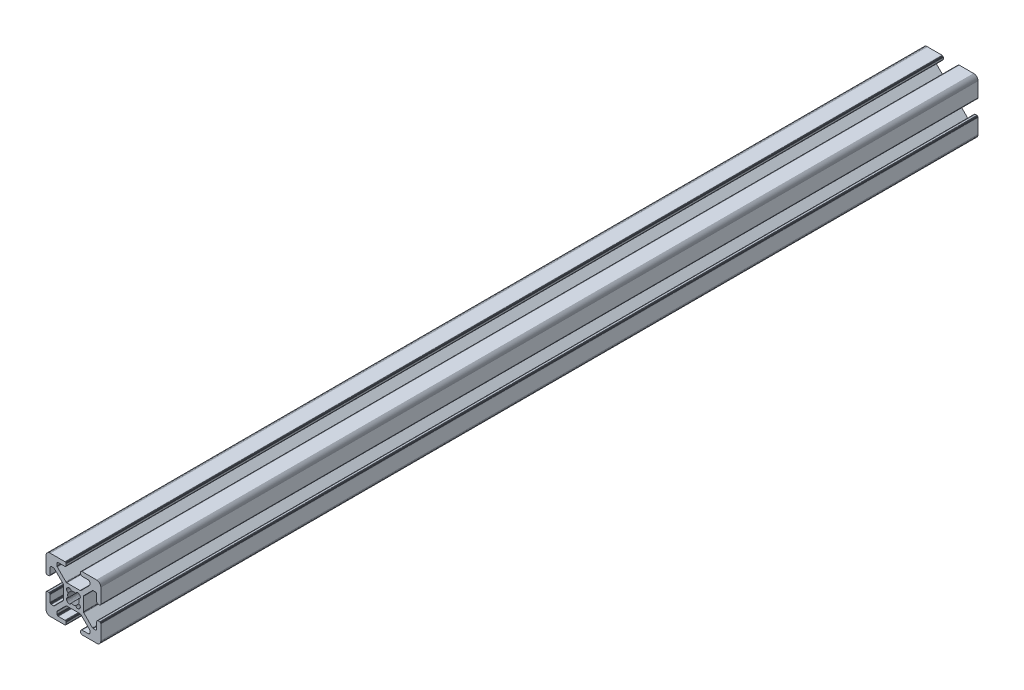
from build123d import *

# Parameters (mm, degrees)
BOSS_EXTRUDE1_DEPTH = 240


with BuildPart() as part:
    # Model → Boss-Extrude1 (new body)
    with BuildSketch(Plane.XY):
        Polygon((949.318453514, 626.491065369), (949.298187669, 626.47654307), (949.278915018, 626.460726414), (949.26071809, 626.443683131), (946.933407593, 624.116372635), (946.91636431, 624.098175706), (946.900547654, 624.078903055), (946.886025355, 624.05863721), (946.872859598, 624.037464951), (946.861106763, 624.015476942), (946.850817175, 623.992767339), (946.842034898, 623.969433387), (946.834797537, 623.945575007), (946.829136085, 623.921294364), (946.825074785, 623.89669543), (946.822631027, 623.871883543), (946.821815277, 623.846964951), (946.821815277, 620.271085943), (946.822631027, 620.246167351), (946.825074785, 620.221355464), (946.829136085, 620.19675653), (946.834797537, 620.172475887), (946.842034898, 620.148617507), (946.850817175, 620.125283555), (946.861106763, 620.102573952), (946.872859598, 620.080585943), (946.886025355, 620.059413684), (946.900547654, 620.039147839), (946.91636431, 620.019875188), (946.933407593, 620.00167826), (949.26071809, 617.674367763), (949.278915018, 617.65732448), (949.298187669, 617.641507824), (949.318453514, 617.626985525), (949.339625773, 617.613819768), (949.361613782, 617.602066933), (949.384323385, 617.591777345), (949.407657337, 617.582995068), (949.431515717, 617.575757707), (949.455796361, 617.570096255), (949.480395294, 617.566034955), (949.505207181, 617.563591197), (949.530125773, 617.562775447), (950.074565277, 617.562775447), (950.124295756, 617.566034955), (950.173175333, 617.575757707), (950.220367665, 617.591777345), (950.265065277, 617.613819768), (950.306503382, 617.641507824), (950.343972961, 617.674367763), (950.3768329, 617.711837343), (950.404520956, 617.753275447), (950.426563379, 617.797973059), (950.442583017, 617.845165391), (950.452305769, 617.894044968), (950.455565277, 617.943775447), (950.455565277, 619.705525447), (950.458824785, 619.755255926), (950.468547537, 619.804135503), (950.484567175, 619.851327835), (950.506609598, 619.896025447), (950.534297654, 619.937463551), (950.567157593, 619.974933131), (950.604627173, 620.00779307), (950.646065277, 620.035481126), (950.690762889, 620.057523549), (950.737955221, 620.073543187), (950.786834798, 620.083265939), (950.836565277, 620.086525447), (951.199565277, 620.086525447), (951.249295756, 620.083265939), (951.298175333, 620.073543187), (951.345367665, 620.057523549), (951.390065277, 620.035481126), (951.431503382, 620.00779307), (951.468972961, 619.974933131), (951.5018329, 619.937463551), (951.529520956, 619.896025447), (951.551563379, 619.851327835), (951.567583017, 619.804135503), (951.577305769, 619.755255926), (951.580565277, 619.705525447), (951.580565277, 615.684025447), (951.570940746, 615.537183481), (951.542231832, 615.392854021), (951.494929751, 615.253506586), (951.429843856, 615.121525447), (951.348087785, 614.999168839), (951.251060406, 614.888530318), (951.140421885, 614.791502939), (951.018065277, 614.709746868), (950.886084138, 614.644660973), (950.746736703, 614.597358892), (950.602407243, 614.568649978), (950.455565277, 614.559025447), (946.434065277, 614.559025447), (946.384334798, 614.562284955), (946.335455221, 614.572007707), (946.288262889, 614.588027345), (946.243565277, 614.610069768), (946.202127173, 614.637757824), (946.164657593, 614.670617763), (946.131797654, 614.708087343), (946.104109598, 614.749525447), (946.082067175, 614.794223059), (946.066047537, 614.841415391), (946.056324785, 614.890294968), (946.053065277, 614.940025447), (946.053065277, 615.303025447), (946.056324785, 615.352755926), (946.066047537, 615.401635503), (946.082067175, 615.448827835), (946.104109598, 615.493525447), (946.131797654, 615.534963551), (946.164657593, 615.572433131), (946.202127173, 615.60529307), (946.243565277, 615.632981126), (946.288262889, 615.655023549), (946.335455221, 615.671043187), (946.384334798, 615.680765939), (946.434065277, 615.684025447), (948.195815277, 615.684025447), (948.245545756, 615.687284955), (948.294425333, 615.697007707), (948.341617665, 615.713027345), (948.386315277, 615.735069768), (948.427753382, 615.762757824), (948.465222961, 615.795617763), (948.4980829, 615.833087343), (948.525770956, 615.874525447), (948.547813379, 615.919223059), (948.563833017, 615.966415391), (948.573555769, 616.015294968), (948.576815277, 616.065025447), (948.576815277, 616.609464951), (948.575999527, 616.634383543), (948.573555769, 616.65919543), (948.569494469, 616.683794364), (948.563833017, 616.708075007), (948.556595656, 616.731933387), (948.547813379, 616.755267339), (948.537523792, 616.777976942), (948.525770956, 616.799964951), (948.512605199, 616.82113721), (948.4980829, 616.841403055), (948.482266244, 616.860675706), (948.465222961, 616.878872635), (946.137912465, 619.206183131), (946.119715536, 619.223226414), (946.100442885, 619.23904307), (946.08017704, 619.253565369), (946.059004781, 619.266731126), (946.037016772, 619.278483962), (946.014307169, 619.288773549), (945.990973217, 619.297555826), (945.967114837, 619.304793187), (945.942834194, 619.310454639), (945.91823526, 619.314515939), (945.893423373, 619.316959697), (945.868504781, 619.317775447), (944.080565277, 619.317775447), (942.292625773, 619.317775447), (942.267707181, 619.316959697), (942.242895294, 619.314515939), (942.218296361, 619.310454639), (942.194015717, 619.304793187), (942.170157337, 619.297555826), (942.146823385, 619.288773549), (942.124113782, 619.278483962), (942.102125773, 619.266731126), (942.080953514, 619.253565369), (942.060687669, 619.23904307), (942.041415018, 619.223226414), (942.02321809, 619.206183131), (939.695907593, 616.878872635), (939.67886431, 616.860675706), (939.663047654, 616.841403055), (939.648525355, 616.82113721), (939.635359598, 616.799964951), (939.623606763, 616.777976942), (939.613317175, 616.755267339), (939.604534898, 616.731933387), (939.597297537, 616.708075007), (939.591636085, 616.683794364), (939.587574785, 616.65919543), (939.585131027, 616.634383543), (939.584315277, 616.609464951), (939.584315277, 616.065025447), (939.587574785, 616.015294968), (939.597297537, 615.966415391), (939.613317175, 615.919223059), (939.635359598, 615.874525447), (939.663047654, 615.833087343), (939.695907593, 615.795617763), (939.733377173, 615.762757824), (939.774815277, 615.735069768), (939.819512889, 615.713027345), (939.866705221, 615.697007707), (939.915584798, 615.687284955), (939.965315277, 615.684025447), (941.727065277, 615.684025447), (941.776795756, 615.680765939), (941.825675333, 615.671043187), (941.872867665, 615.655023549), (941.917565277, 615.632981126), (941.959003382, 615.60529307), (941.996472961, 615.572433131), (942.0293329, 615.534963551), (942.057020956, 615.493525447), (942.079063379, 615.448827835), (942.095083017, 615.401635503), (942.104805769, 615.352755926), (942.108065277, 615.303025447), (942.108065277, 614.940025447), (942.104805769, 614.890294968), (942.095083017, 614.841415391), (942.079063379, 614.794223059), (942.057020956, 614.749525447), (942.0293329, 614.708087343), (941.996472961, 614.670617763), (941.959003382, 614.637757824), (941.917565277, 614.610069768), (941.872867665, 614.588027345), (941.825675333, 614.572007707), (941.776795756, 614.562284955), (941.727065277, 614.559025447), (937.705565277, 614.559025447), (937.558723311, 614.568649978), (937.414393851, 614.597358892), (937.275046416, 614.644660973), (937.143065277, 614.709746868), (937.020708669, 614.791502939), (936.910070148, 614.888530318), (936.813042769, 614.999168839), (936.731286698, 615.121525447), (936.666200803, 615.253506586), (936.618898722, 615.392854021), (936.590189808, 615.537183481), (936.580565277, 615.684025447), (936.580565277, 619.705525447), (936.583824785, 619.755255926), (936.593547537, 619.804135503), (936.609567175, 619.851327835), (936.631609598, 619.896025447), (936.659297654, 619.937463551), (936.692157593, 619.974933131), (936.729627173, 620.00779307), (936.771065277, 620.035481126), (936.815762889, 620.057523549), (936.862955221, 620.073543187), (936.911834798, 620.083265939), (936.961565277, 620.086525447), (937.324565277, 620.086525447), (937.374295756, 620.083265939), (937.423175333, 620.073543187), (937.470367665, 620.057523549), (937.515065277, 620.035481126), (937.556503382, 620.00779307), (937.593972961, 619.974933131), (937.6268329, 619.937463551), (937.654520956, 619.896025447), (937.676563379, 619.851327835), (937.692583017, 619.804135503), (937.702305769, 619.755255926), (937.705565277, 619.705525447), (937.705565277, 617.943775447), (937.708824785, 617.894044968), (937.718547537, 617.845165391), (937.734567175, 617.797973059), (937.756609598, 617.753275447), (937.784297654, 617.711837343), (937.817157593, 617.674367763), (937.854627173, 617.641507824), (937.896065277, 617.613819768), (937.940762889, 617.591777345), (937.987955221, 617.575757707), (938.036834798, 617.566034955), (938.086565277, 617.562775447), (938.631004781, 617.562775447), (938.655923373, 617.563591197), (938.68073526, 617.566034955), (938.705334194, 617.570096255), (938.729614837, 617.575757707), (938.753473217, 617.582995068), (938.776807169, 617.591777345), (938.799516772, 617.602066933), (938.821504781, 617.613819768), (938.84267704, 617.626985525), (938.862942885, 617.641507824), (938.882215536, 617.65732448), (938.900412465, 617.674367763), (941.227722961, 620.00167826), (941.244766244, 620.019875188), (941.2605829, 620.039147839), (941.275105199, 620.059413684), (941.288270956, 620.080585943), (941.300023792, 620.102573952), (941.310313379, 620.125283555), (941.319095656, 620.148617507), (941.326333017, 620.172475887), (941.331994469, 620.19675653), (941.336055769, 620.221355464), (941.338499527, 620.246167351), (941.339315277, 620.271085943), (941.339315277, 623.846964951), (941.338499527, 623.871883543), (941.336055769, 623.89669543), (941.331994469, 623.921294364), (941.326333017, 623.945575007), (941.319095656, 623.969433387), (941.310313379, 623.992767339), (941.300023792, 624.015476942), (941.288270956, 624.037464951), (941.275105199, 624.05863721), (941.2605829, 624.078903055), (941.244766244, 624.098175706), (941.227722961, 624.116372635), (938.900412465, 626.443683131), (938.882215537, 626.460726414), (938.862942885, 626.47654307), (938.84267704, 626.491065369), (938.821504781, 626.504231126), (938.799516772, 626.515983962), (938.776807169, 626.526273549), (938.753473217, 626.535055826), (938.729614837, 626.542293187), (938.705334194, 626.547954639), (938.68073526, 626.552015939), (938.655923373, 626.554459697), (938.631004781, 626.555275447), (938.086565277, 626.555275447), (938.036834798, 626.552015939), (937.987955221, 626.542293187), (937.940762889, 626.526273549), (937.896065277, 626.504231126), (937.854627173, 626.47654307), (937.817157593, 626.443683131), (937.784297654, 626.406213552), (937.756609598, 626.364775447), (937.734567175, 626.320077835), (937.718547537, 626.272885503), (937.708824785, 626.224005926), (937.705565277, 626.174275447), (937.705565277, 624.412525447), (937.702305769, 624.362794968), (937.692583017, 624.313915391), (937.676563379, 624.266723059), (937.654520956, 624.222025447), (937.6268329, 624.180587343), (937.593972961, 624.143117763), (937.556503382, 624.110257824), (937.515065277, 624.082569768), (937.470367665, 624.060527345), (937.423175333, 624.044507707), (937.374295756, 624.034784955), (937.324565277, 624.031525447), (936.961565277, 624.031525447), (936.911834798, 624.034784955), (936.862955221, 624.044507707), (936.815762889, 624.060527345), (936.771065277, 624.082569768), (936.729627173, 624.110257824), (936.692157593, 624.143117763), (936.659297654, 624.180587343), (936.631609598, 624.222025447), (936.609567175, 624.266723059), (936.593547537, 624.313915391), (936.583824785, 624.362794968), (936.580565277, 624.412525447), (936.580565277, 628.434025447), (936.590189808, 628.580867413), (936.618898723, 628.725196873), (936.666200803, 628.864544308), (936.731286698, 628.996525447), (936.813042769, 629.118882055), (936.910070148, 629.229520576), (937.020708669, 629.326547955), (937.143065277, 629.408304026), (937.275046416, 629.473389921), (937.414393851, 629.520692002), (937.558723311, 629.549400916), (937.705565277, 629.559025447), (941.727065277, 629.559025447), (941.776795756, 629.555765939), (941.825675333, 629.546043187), (941.872867665, 629.530023549), (941.917565277, 629.507981126), (941.959003382, 629.48029307), (941.996472961, 629.447433131), (942.0293329, 629.409963552), (942.057020956, 629.368525447), (942.079063379, 629.323827835), (942.095083017, 629.276635503), (942.104805769, 629.227755926), (942.108065277, 629.178025447), (942.108065277, 628.815025447), (942.104805769, 628.765294968), (942.095083017, 628.716415391), (942.079063379, 628.669223059), (942.057020956, 628.624525447), (942.0293329, 628.583087343), (941.996472961, 628.545617763), (941.959003382, 628.512757824), (941.917565277, 628.485069768), (941.872867665, 628.463027345), (941.825675333, 628.447007707), (941.776795756, 628.437284955), (941.727065277, 628.434025447), (939.965315277, 628.434025447), (939.915584798, 628.430765939), (939.866705221, 628.421043187), (939.819512889, 628.405023549), (939.774815277, 628.382981126), (939.733377173, 628.35529307), (939.695907593, 628.322433131), (939.663047654, 628.284963552), (939.635359598, 628.243525447), (939.613317175, 628.198827835), (939.597297537, 628.151635503), (939.587574785, 628.102755926), (939.584315277, 628.053025447), (939.584315277, 627.508585943), (939.585131027, 627.483667351), (939.587574785, 627.458855464), (939.591636085, 627.43425653), (939.597297537, 627.409975887), (939.604534898, 627.386117507), (939.613317175, 627.362783555), (939.623606763, 627.340073952), (939.635359598, 627.318085943), (939.648525355, 627.296913684), (939.663047654, 627.276647839), (939.67886431, 627.257375188), (939.695907593, 627.23917826), (942.02321809, 624.911867763), (942.041415018, 624.89482448), (942.060687669, 624.879007824), (942.080953514, 624.864485525), (942.102125773, 624.851319768), (942.124113782, 624.839566933), (942.146823385, 624.829277345), (942.170157337, 624.820495068), (942.194015717, 624.813257707), (942.218296361, 624.807596255), (942.242895294, 624.803534955), (942.267707181, 624.801091197), (942.292625773, 624.800275447), (944.080565277, 624.800275447), (945.868504781, 624.800275447), (945.893423373, 624.801091197), (945.91823526, 624.803534955), (945.942834194, 624.807596255), (945.967114837, 624.813257707), (945.990973217, 624.820495068), (946.014307169, 624.829277345), (946.037016772, 624.839566933), (946.059004781, 624.851319768), (946.08017704, 624.864485525), (946.100442885, 624.879007824), (946.119715536, 624.89482448), (946.137912465, 624.911867763), (948.465222961, 627.23917826), (948.482266244, 627.257375188), (948.4980829, 627.276647839), (948.512605199, 627.296913684), (948.525770956, 627.318085943), (948.537523792, 627.340073952), (948.547813379, 627.362783555), (948.556595656, 627.386117507), (948.563833017, 627.409975887), (948.569494469, 627.43425653), (948.573555769, 627.458855464), (948.575999527, 627.483667351), (948.576815277, 627.508585943), (948.576815277, 628.053025447), (948.573555769, 628.102755926), (948.563833017, 628.151635503), (948.547813379, 628.198827835), (948.525770956, 628.243525447), (948.4980829, 628.284963552), (948.465222961, 628.322433131), (948.427753382, 628.35529307), (948.386315277, 628.382981126), (948.341617665, 628.405023549), (948.294425333, 628.421043187), (948.245545756, 628.430765939), (948.195815277, 628.434025447), (946.434065277, 628.434025447), (946.384334798, 628.437284955), (946.335455221, 628.447007707), (946.288262889, 628.463027345), (946.243565277, 628.485069768), (946.202127173, 628.512757824), (946.164657593, 628.545617763), (946.131797654, 628.583087343), (946.104109598, 628.624525447), (946.082067175, 628.669223059), (946.066047537, 628.716415391), (946.056324785, 628.765294968), (946.053065277, 628.815025447), (946.053065277, 629.178025447), (946.056324785, 629.227755926), (946.066047537, 629.276635503), (946.082067175, 629.323827835), (946.104109598, 629.368525447), (946.131797654, 629.409963552), (946.164657593, 629.447433131), (946.202127173, 629.48029307), (946.243565277, 629.507981126), (946.288262889, 629.530023549), (946.335455221, 629.546043187), (946.384334798, 629.555765939), (946.434065277, 629.559025447), (950.455565277, 629.559025447), (950.602407243, 629.549400916), (950.746736703, 629.520692002), (950.886084138, 629.473389921), (951.018065277, 629.408304026), (951.140421885, 629.326547955), (951.251060406, 629.229520576), (951.348087785, 629.118882055), (951.429843856, 628.996525447), (951.494929751, 628.864544308), (951.542231832, 628.725196873), (951.570940746, 628.580867413), (951.580565277, 628.434025447), (951.580565277, 624.412525447), (951.577305769, 624.362794968), (951.567583017, 624.313915391), (951.551563379, 624.266723059), (951.529520956, 624.222025447), (951.5018329, 624.180587343), (951.468972961, 624.143117763), (951.431503382, 624.110257824), (951.390065277, 624.082569768), (951.345367665, 624.060527345), (951.298175333, 624.044507707), (951.249295756, 624.034784955), (951.199565277, 624.031525447), (950.836565277, 624.031525447), (950.786834798, 624.034784955), (950.737955221, 624.044507707), (950.690762889, 624.060527345), (950.646065277, 624.082569768), (950.604627173, 624.110257824), (950.567157593, 624.143117763), (950.534297654, 624.180587343), (950.506609598, 624.222025447), (950.484567175, 624.266723059), (950.468547537, 624.313915391), (950.458824785, 624.362794968), (950.455565277, 624.412525447), (950.455565277, 626.174275447), (950.452305769, 626.224005926), (950.442583017, 626.272885503), (950.426563379, 626.320077835), (950.404520956, 626.364775447), (950.3768329, 626.406213552), (950.343972961, 626.443683131), (950.306503382, 626.47654307), (950.265065277, 626.504231126), (950.220367665, 626.526273549), (950.173175333, 626.542293187), (950.124295756, 626.552015939), (950.074565277, 626.555275447), (949.530125773, 626.555275447), (949.505207181, 626.554459697), (949.480395294, 626.552015939), (949.45579636, 626.547954639), (949.431515717, 626.542293187), (949.407657337, 626.535055826), (949.384323385, 626.526273549), (949.361613782, 626.515983962), (949.339625773, 626.504231126), align=None)
        Polygon((944.080565277, 620.487400447), (944.183633133, 620.490783706), (944.286257238, 620.500918917), (944.387995751, 620.517762444), (944.488410645, 620.541241768), (944.587069589, 620.5712558), (944.683547816, 620.607675317), (944.717059299, 620.509272694), (944.767314012, 620.418275113), (944.832753214, 620.337505027), (944.911347192, 620.269467666), (945.000658212, 620.216273329), (945.097916135, 620.179571935), (945.200104331, 620.160501841), (945.304053251, 620.159654543), (945.406538734, 620.177056319), (945.504382008, 620.212167424), (945.594548289, 620.263898822), (945.67424091, 620.330645972), (945.808944752, 620.465349814), (945.875691902, 620.545042435), (945.927423301, 620.635208716), (945.962534405, 620.73305199), (945.979936181, 620.835537473), (945.979088883, 620.939486393), (945.96001879, 621.041674589), (945.923317395, 621.138932512), (945.870123058, 621.228243532), (945.802085697, 621.30683751), (945.721315612, 621.372276713), (945.630318031, 621.422531425), (945.531915407, 621.456042909), (945.568334924, 621.552521135), (945.598348956, 621.651180079), (945.62182828, 621.751594973), (945.638671807, 621.853333486), (945.648807018, 621.955957591), (945.652190277, 622.059025447), (945.648807018, 622.162093303), (945.638671807, 622.264717408), (945.62182828, 622.366455921), (945.598348956, 622.466870815), (945.568334924, 622.565529759), (945.531915407, 622.662007986), (945.630318031, 622.695519469), (945.721315612, 622.745774181), (945.802085697, 622.811213384), (945.870123058, 622.889807362), (945.923317395, 622.979118382), (945.96001879, 623.076376305), (945.979088883, 623.178564501), (945.979936181, 623.282513421), (945.962534405, 623.384998904), (945.927423301, 623.482842178), (945.875691902, 623.573008459), (945.808944752, 623.65270108), (945.67424091, 623.787404922), (945.594548289, 623.854152072), (945.504382008, 623.905883471), (945.406538734, 623.940994575), (945.304053251, 623.958396351), (945.200104331, 623.957549053), (945.097916135, 623.93847896), (945.000658212, 623.901777565), (944.911347192, 623.848583228), (944.832753214, 623.780545867), (944.767314012, 623.699775782), (944.717059299, 623.608778201), (944.683547816, 623.510375577), (944.587069589, 623.546795094), (944.488410645, 623.576809126), (944.387995751, 623.60028845), (944.286257238, 623.617131977), (944.183633133, 623.627267188), (944.080565277, 623.630650447), (943.977497421, 623.627267188), (943.874873316, 623.617131977), (943.773134803, 623.60028845), (943.672719909, 623.576809126), (943.574060965, 623.546795094), (943.477582739, 623.510375577), (943.444071255, 623.608778201), (943.393816543, 623.699775782), (943.32837734, 623.780545867), (943.249783362, 623.848583228), (943.160472342, 623.901777565), (943.063214419, 623.93847896), (942.961026223, 623.957549053), (942.857077303, 623.958396351), (942.75459182, 623.940994575), (942.656748546, 623.905883471), (942.566582265, 623.854152072), (942.486889644, 623.787404922), (942.352185802, 623.65270108), (942.285438652, 623.573008459), (942.233707254, 623.482842178), (942.198596149, 623.384998904), (942.181194373, 623.282513421), (942.182041671, 623.178564501), (942.201111765, 623.076376305), (942.237813159, 622.979118382), (942.291007496, 622.889807362), (942.359044857, 622.811213384), (942.439814943, 622.745774181), (942.530812524, 622.695519469), (942.629215147, 622.662007986), (942.59279563, 622.565529759), (942.562781598, 622.466870815), (942.539302274, 622.366455921), (942.522458747, 622.264717408), (942.512323536, 622.162093303), (942.508940277, 622.059025447), (942.512323536, 621.955957591), (942.522458747, 621.853333486), (942.539302274, 621.751594973), (942.562781598, 621.651180079), (942.59279563, 621.552521135), (942.629215147, 621.456042909), (942.530812524, 621.422531425), (942.439814943, 621.372276713), (942.359044857, 621.30683751), (942.291007496, 621.228243532), (942.237813159, 621.138932512), (942.201111765, 621.041674589), (942.182041671, 620.939486393), (942.181194373, 620.835537473), (942.198596149, 620.73305199), (942.233707254, 620.635208716), (942.285438652, 620.545042435), (942.352185802, 620.465349814), (942.486889644, 620.330645972), (942.566582265, 620.263898822), (942.656748546, 620.212167424), (942.75459182, 620.177056319), (942.857077303, 620.159654543), (942.961026223, 620.160501841), (943.063214419, 620.179571935), (943.160472342, 620.216273329), (943.249783362, 620.269467666), (943.32837734, 620.337505027), (943.393816543, 620.418275113), (943.444071255, 620.509272694), (943.477582739, 620.607675317), (943.574060965, 620.5712558), (943.672719909, 620.541241768), (943.773134803, 620.517762444), (943.874873316, 620.500918917), (943.977497421, 620.490783706), align=None, mode=Mode.SUBTRACT)
    extrude(amount=BOSS_EXTRUDE1_DEPTH)


solid = part.part
